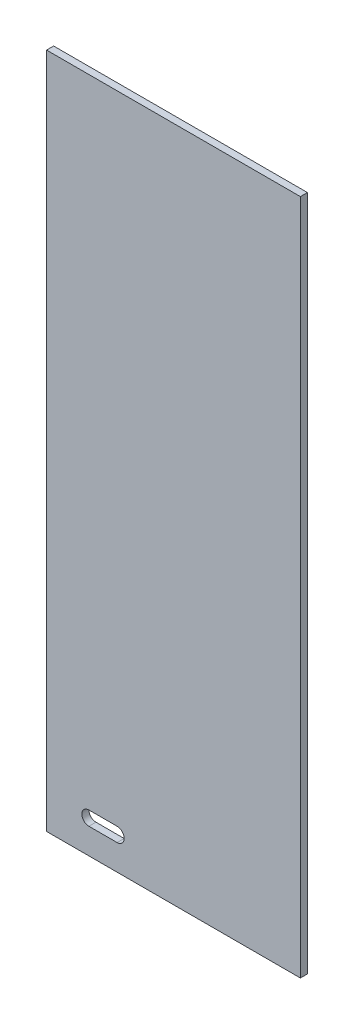
from build123d import *

# Parameters (mm, degrees)
SKETCH1_W           = 228.6
SKETCH1_H           = 609.6
BOSS_EXTRUDE1_DEPTH = 6.35
CUT_EXTRUDE1_DEPTH  = 6.35


with BuildPart() as part:
    # Sketch1 → Boss-Extrude1 (new body)
    with BuildSketch(Plane.XY):
        with Locations((-114.3, 304.8)):
            Rectangle(SKETCH1_W, SKETCH1_H)
    extrude(amount=BOSS_EXTRUDE1_DEPTH)

    # Sketch2 → Cut-Extrude1 (cut)
    with BuildSketch(Plane.XY.offset(6.35)):
        with BuildLine():
            Line((-165.095373919, 23.135327723), (-190.495373919, 23.135327723))
            ThreePointArc((-190.495373919, 23.135327723), (-196.845373919, 29.485327723), (-190.495373919, 35.835327723))
            Line((-190.495373919, 35.835327723), (-165.095373919, 35.835327723))
            ThreePointArc((-165.095373919, 35.835327723), (-158.745373919, 29.485327723), (-165.095373919, 23.135327723))
        make_face()
    extrude(amount=-CUT_EXTRUDE1_DEPTH, mode=Mode.SUBTRACT)


solid = part.part
